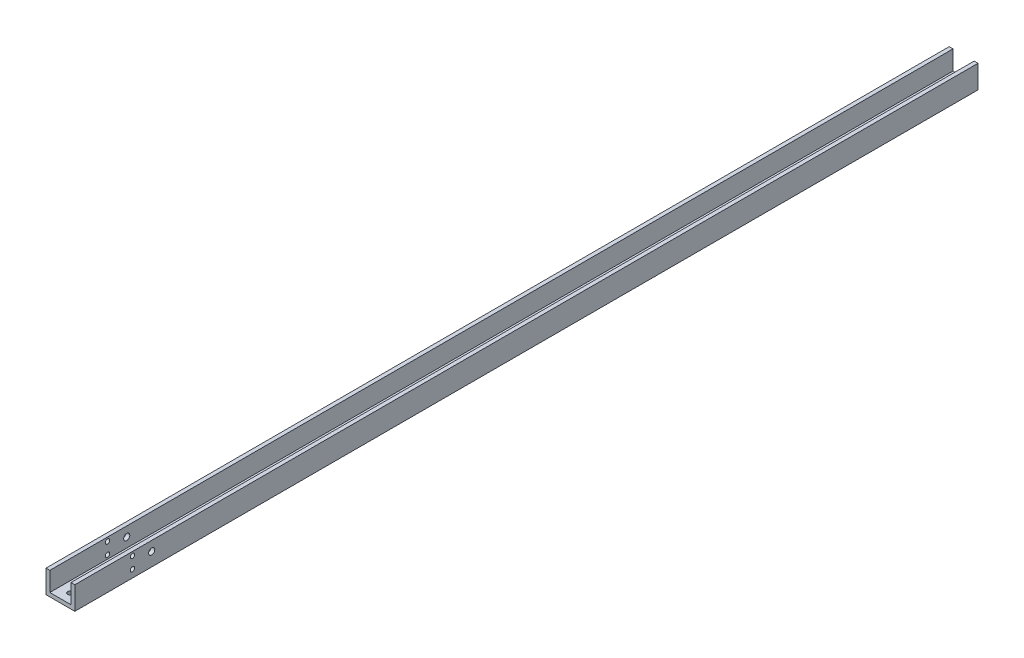
from build123d import *

# Parameters (mm, degrees)
BOSS_EXTRU_1_DEPTH                        = 470
ESQUISSE2_R                               = 1.15
ESQUISSE2_R_2                             = 1.6
ENL_V_MAT_EXTRU_1_DEPTH                   = 471.392389394
TROU_POUR_TARAUDAGE_POUR_TROU_TARAUD_M3_D = 2.5


with BuildPart() as part:
    # Esquisse1 → Boss.-Extru.1 (new body)
    with BuildSketch(Plane.XY):
        Polygon((-7.5, 0), (7.5, 0), (7.5, 12), (5.5, 12), (5.5, 2), (-5.5, 2), (-5.5, 12), (-7.5, 12), align=None)
    extrude(amount=BOSS_EXTRU_1_DEPTH)

    # Esquisse2 → Enlèv. mat.-Extru.1 (cut, through all)
    with BuildSketch(Plane(origin=(7.5, 0, 0), x_dir=(0, 0, -1), z_dir=(1, 0, 0))):
        with Locations((-440, 10)):
            Circle(ESQUISSE2_R)
        with Locations((-440, 4)):
            Circle(ESQUISSE2_R)
        with Locations((-430, 7)):
            Circle(ESQUISSE2_R_2)
    extrude(amount=-ENL_V_MAT_EXTRU_1_DEPTH, mode=Mode.SUBTRACT)

    # Trou pour taraudage pour trou taraudé M31 (through all)
    with Locations(Plane(origin=(0, 2, 0), x_dir=(1, 0, 0), z_dir=(0, 1, 0))):
        with Locations((0, -465)):
            Hole(TROU_POUR_TARAUDAGE_POUR_TROU_TARAUD_M3_D / 2)


solid = part.part
